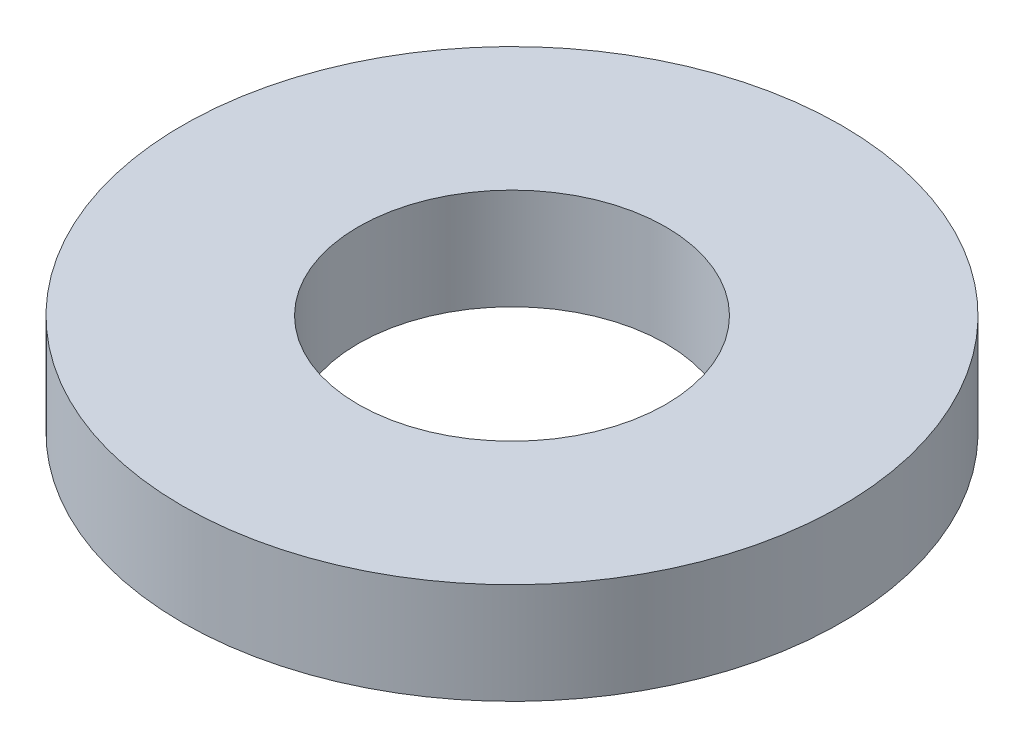
from build123d import *

# Parameters (mm, degrees)
SKETCH1_R           = 75
BOSS_EXTRUDE1_DEPTH = 23
SKETCH2_R           = 35
CUT_EXTRUDE1_DEPTH  = 109.531101533


with BuildPart() as part:
    # Sketch1 → Boss-Extrude1 (new body)
    with BuildSketch(Plane(origin=(0, 0, 0), x_dir=(1, 0, 0), z_dir=(0, 1, 0))):
        Circle(SKETCH1_R)
    extrude(amount=BOSS_EXTRUDE1_DEPTH)

    # Sketch2 → Cut-Extrude1 (cut, through all)
    with BuildSketch(Plane(origin=(0, 0, 0), x_dir=(1, 0, 0), z_dir=(0, 1, 0))):
        Circle(SKETCH2_R)
    extrude(amount=CUT_EXTRUDE1_DEPTH, mode=Mode.SUBTRACT)


solid = part.part
